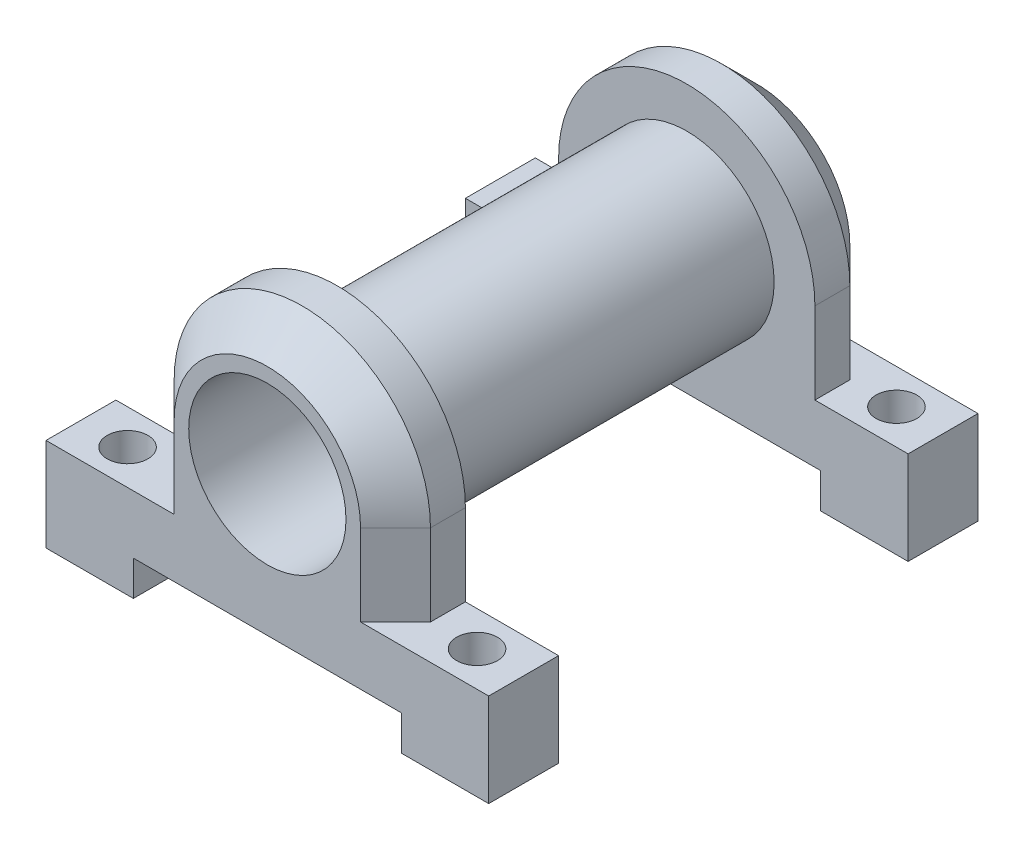
from build123d import *

# Parameters (mm, degrees)
BOSS_EXTRUDE1_DEPTH     = 6
SKETCH2_R               = 7.5
BOSS_EXTRUDE2_DEPTH     = 30
BOSS_EXTRUDE3_DEPTH     = 6
SKETCH4_R               = 6.75
CUT_EXTRUDE1_DEPTH      = 49.476798574
CUT_EXTRUDE2_DEPTH      = 49.476798574
CUT_EXTRUDE2_DEPTH_BACK = 49.476798574
SKETCH5_W               = 23
SKETCH5_H               = 3
SKETCH6_R               = 1.75
CUT_EXTRUDE3_DEPTH      = 50.487372127
CHAMFER1_SIZE           = 3


with BuildPart() as part:
    # Sketch1 → Boss-Extrude1 (new body)
    with BuildSketch(Plane.XY):
        with BuildLine():
            Line((-11, 0), (-11, -7))
            Line((-11, -7), (-19, -7))
            Line((-19, -7), (-19, -15))
            Line((-19, -15), (-11, -15))
            Line((-11, -15), (11, -15))
            Line((11, -15), (19, -15))
            Line((19, -15), (19, -7))
            Line((19, -7), (11, -7))
            Line((11, -7), (11, 0))
            ThreePointArc((11, 0), (0, 11), (-11, 0))
        make_face()
    extrude(amount=BOSS_EXTRUDE1_DEPTH)

    # Sketch2 → Boss-Extrude2 (add)
    with BuildSketch(Plane.XY.offset(6)):
        Circle(SKETCH2_R)
    extrude(amount=BOSS_EXTRUDE2_DEPTH)

    # Sketch3 → Boss-Extrude3 (add)
    with BuildSketch(Plane.XY.offset(36)):
        with BuildLine():
            Line((-11, 0), (-11, -7))
            Line((-11, -7), (-19, -7))
            Line((-19, -7), (-19, -15))
            Line((-19, -15), (19, -15))
            Line((19, -15), (19, -7))
            Line((19, -7), (11, -7))
            Line((11, -7), (11, 0))
            ThreePointArc((11, 0), (0, 11), (-11, 0))
        make_face()
    extrude(amount=BOSS_EXTRUDE3_DEPTH)

    # Sketch4 → Cut-Extrude1 (cut, through all)
    with BuildSketch(Plane.XY.offset(42)):
        Circle(SKETCH4_R)
    extrude(amount=-CUT_EXTRUDE1_DEPTH, mode=Mode.SUBTRACT)

    # Sketch5 → Cut-Extrude2 (cut, two sides: drawn at the far end of the back side and taken through both)
    with BuildSketch(Plane(origin=(0, 0, 0), x_dir=(-1, 0, 0), z_dir=(0, 0, -1)).offset(-CUT_EXTRUDE2_DEPTH_BACK)):
        with Locations((0, -13.5)):
            Rectangle(SKETCH5_W, SKETCH5_H)
    extrude(amount=CUT_EXTRUDE2_DEPTH + CUT_EXTRUDE2_DEPTH_BACK, mode=Mode.SUBTRACT)

    # Sketch6 → Cut-Extrude3 (cut, through all)
    with BuildSketch(Plane(origin=(0, -7, 0), x_dir=(1, 0, 0), z_dir=(0, 1, 0))):
        with Locations((-15, -3)):
            Circle(SKETCH6_R)
        with Locations((15, -3)):
            Circle(SKETCH6_R)
        with Locations((15, -39)):
            Circle(SKETCH6_R)
        with Locations((-15, -39)):
            Circle(SKETCH6_R)
    extrude(amount=-CUT_EXTRUDE3_DEPTH, mode=Mode.SUBTRACT)

    # Chamfer1
    chamfer1_edges = [part.edges().sort_by_distance(p)[0] for p in [
        (11, -3.5, 42),
        (0, 11, 42),
        (-11, -3.5, 42),
        (11, -3.5, 0),
        (0, 11, 0),
        (-11, -3.5, 0),
    ]]
    chamfer(chamfer1_edges, length=CHAMFER1_SIZE)


solid = part.part
